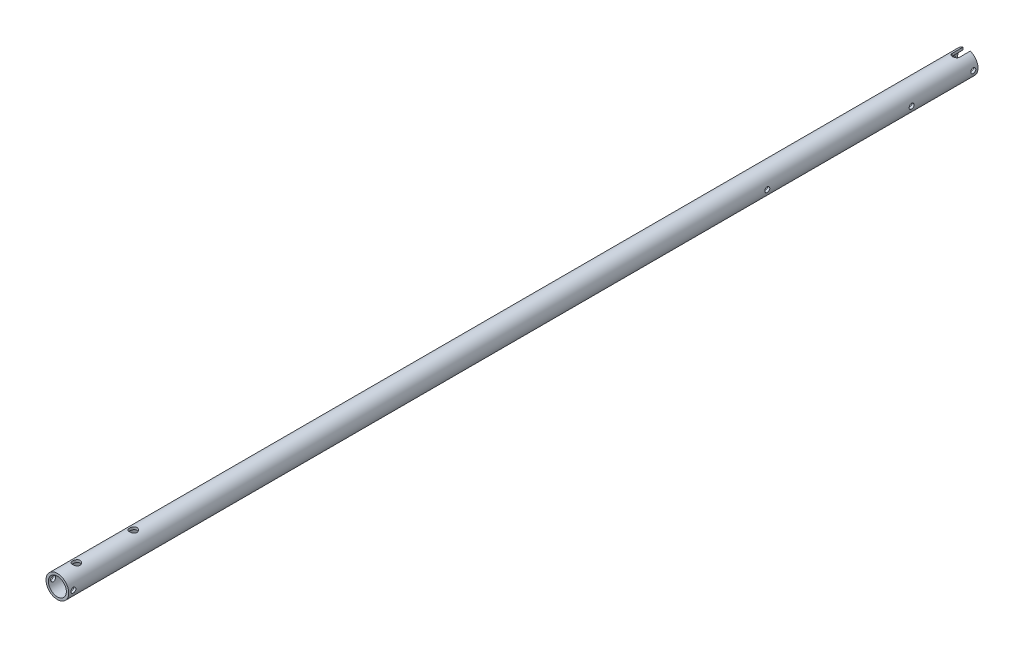
from build123d import *

# Parameters (mm, degrees)
SKETCH1_R               = 15.24
SKETCH1_R_2             = 12.065
BOSS_EXTRUDE1_DEPTH     = 1219.2
F_3_8_CLEARANCE_HOLE1_D = 10.0838
F_1_4_CLEARANCE_HOLE3_D = 6.7564
CUT_EXTRUDE1_DEPTH      = 1220.676157122


with BuildPart() as part:
    # Sketch1 → Boss-Extrude1 (new body)
    with BuildSketch(Plane.XY):
        Circle(SKETCH1_R)
        Circle(SKETCH1_R_2, mode=Mode.SUBTRACT)
    extrude(amount=BOSS_EXTRUDE1_DEPTH)

    # 3/8 Clearance Hole1 (through all)
    with Locations(Plane(origin=(0, -15.24, 0), x_dir=(-1, 0, 0), z_dir=(0, -1, 0))):
        with Locations((0, -1193.8), (0, -1117.6)):
            Hole(F_3_8_CLEARANCE_HOLE1_D / 2)

    # 1/4 Clearance Hole3 (through all)
    with Locations(Plane.ZY.offset(15.24)):
        with Locations((88.9, 0), (282.575, 0), (6.35, 0), (1212.85, 0)):
            Hole(F_1_4_CLEARANCE_HOLE3_D / 2)

    # Sketch12 → Cut-Extrude1 (cut, through all)
    with BuildSketch(Plane(origin=(0, -15.24, 0), x_dir=(-1, 0, 0), z_dir=(0, -1, 0))):
        with BuildLine():
            Line((0, 0), (4.7625, 0))
            Line((4.7625, 0), (4.7625, -14.2875))
            ThreePointArc((4.7625, -14.2875), (0, -19.05), (-4.7625, -14.2875))
            Line((-4.7625, -14.2875), (-4.7625, 0))
            Line((-4.7625, 0), (0, 0))
        make_face()
    extrude(amount=-CUT_EXTRUDE1_DEPTH, mode=Mode.SUBTRACT)


solid = part.part
